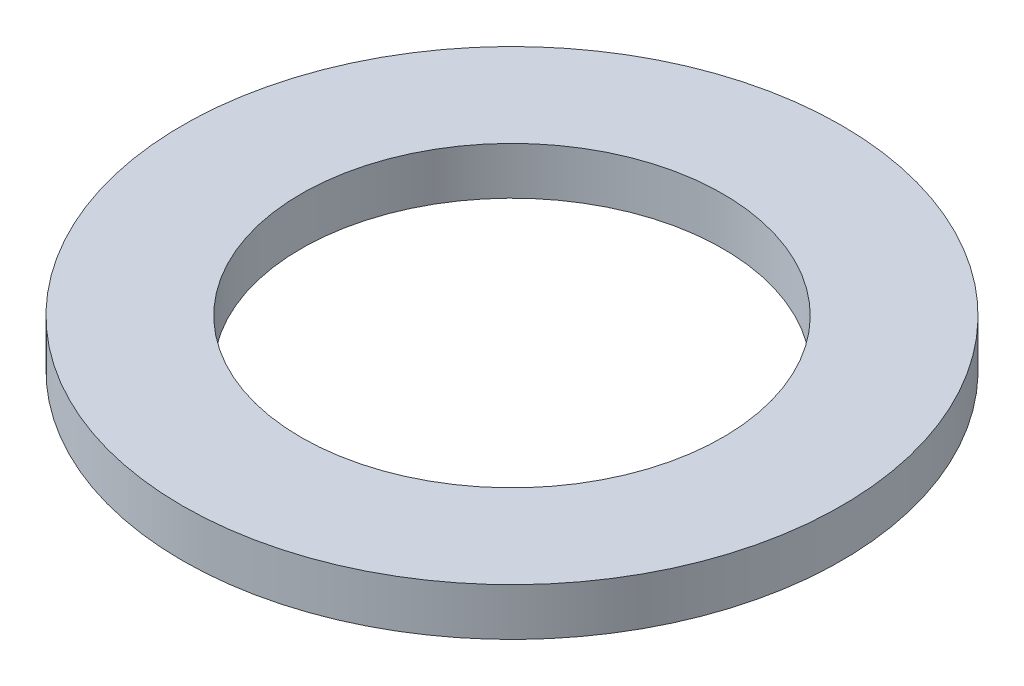
from build123d import *

# Parameters (mm, degrees)
SKETCH1_R           = 62.5
BOSS_EXTRUDE1_DEPTH = 9
SKETCH2_R           = 40
CUT_EXTRUDE1_DEPTH  = 89.845371292


with BuildPart() as part:
    # Sketch1 → Boss-Extrude1 (new body)
    with BuildSketch(Plane(origin=(0, 0, 0), x_dir=(1, 0, 0), z_dir=(0, 1, 0))):
        Circle(SKETCH1_R)
    extrude(amount=BOSS_EXTRUDE1_DEPTH)

    # Sketch2 → Cut-Extrude1 (cut, through all)
    with BuildSketch(Plane(origin=(0, 0, 0), x_dir=(1, 0, 0), z_dir=(0, 1, 0))):
        Circle(SKETCH2_R)
    extrude(amount=CUT_EXTRUDE1_DEPTH, mode=Mode.SUBTRACT)


solid = part.part
